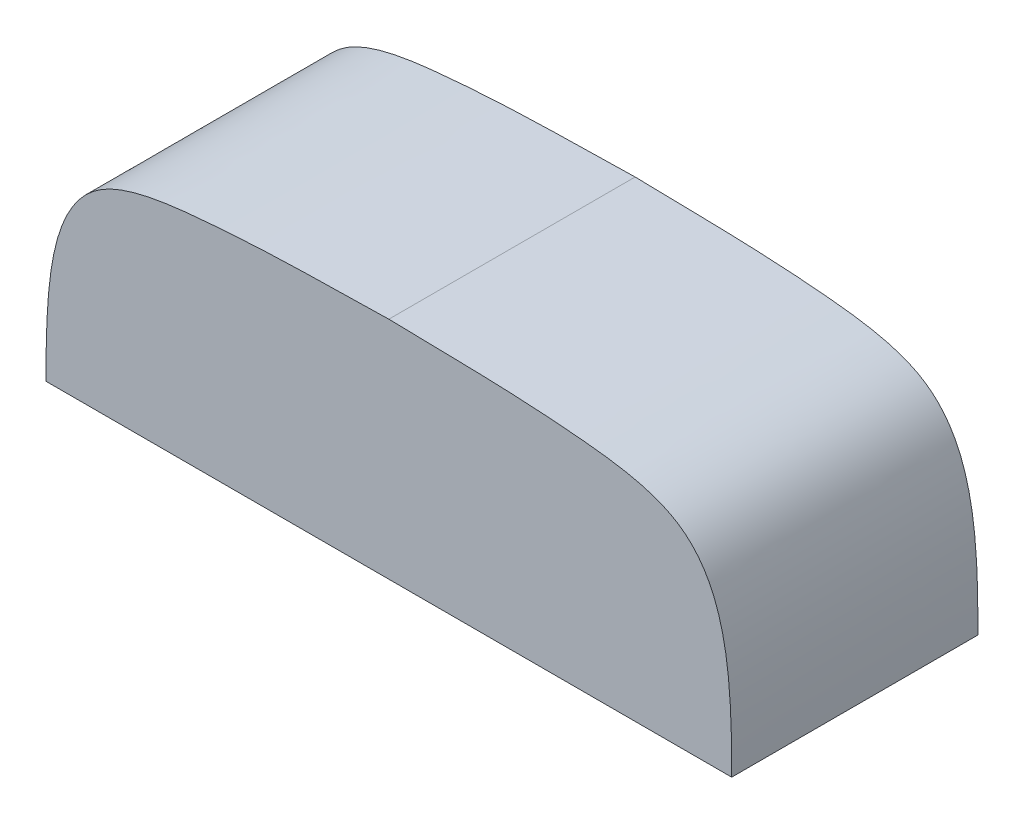
from build123d import *

# Parameters (mm, degrees)
BOSS_EXTRUDE1_DEPTH = 254


with BuildPart() as part:
    # Sketch1 → Boss-Extrude1 (new body)
    with BuildSketch(Plane.XY):
        with BuildLine():
            Line((-353.568, 0), (353.568, 0))
            add(Edge.make_bspline(
                [(0, 232.258315543), (64.449721609, 230.63437227), (158.669793038, 231.087982089), (348.71125285, 205.179836695), (353.551010646, 85.402914772), (353.568, 0)],
                knots=[0, 0, 0, 0, 0.225226498, 0.337839747, 0.5719992, 0.5719992, 0.5719992, 0.5719992], degree=3))
            add(Edge.make_bspline(
                [(0, 232.258315543), (-64.449721609, 230.63437227), (-158.669793038, 231.087982089), (-348.71125285, 205.179836695), (-353.551010646, 85.402914772), (-353.568, 0)],
                knots=[0, 0, 0, 0, 0.225226498, 0.337839747, 0.5719992, 0.5719992, 0.5719992, 0.5719992], degree=3))
        make_face()
    extrude(amount=BOSS_EXTRUDE1_DEPTH)


solid = part.part
